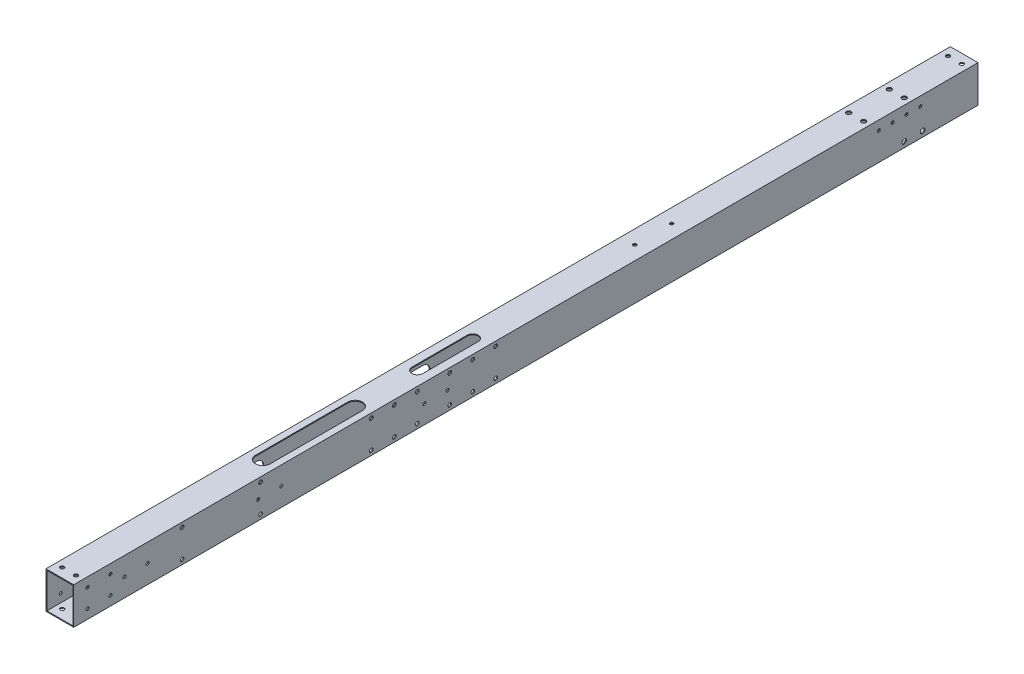
from build123d import *

# Parameters (mm, degrees)
SKETCH_1_W           = 30
SKETCH_1_H           = 40
SKETCH_1_W_2         = 28
SKETCH_1_H_2         = 38
EXTRUDE_1_DEPTH      = 940
SKETCH_5_R           = 2.5
CUT_EXTRUDE_3_DEPTH  = 941.97024395
CUT_EXTRUDE_4_DEPTH  = 1
SKETCH_7_R           = 1.5
CUT_EXTRUDE_5_DEPTH  = 1
SKETCH_17_W          = 30
SKETCH_17_H          = 40
SKETCH_17_W_2        = 28
SKETCH_17_H_2        = 38
EXTRUDE_2_DEPTH      = 20
SKETCH_18_W          = 30
SKETCH_18_H          = 40
SKETCH_18_W_2        = 28
SKETCH_18_H_2        = 38
EXTRUDE_3_DEPTH      = 20
SKETCH_19_R          = 2.1
CUT_EXTRUDE_16_DEPTH = 961.950050731
SKETCH_20_R          = 1.6
CUT_EXTRUDE_17_DEPTH = 961.67684473
SKETCH_21_R          = 2.5
SKETCH_21_R_2        = 1.6
CUT_EXTRUDE_18_DEPTH = 961.67684473
SKETCH_23_R          = 2.5
CUT_EXTRUDE_19_DEPTH = 961.950050731
SKETCH_24_R          = 4.5
CUT_EXTRUDE_20_DEPTH = 10
SKETCH_25_W          = 114.67616049
SKETCH_25_H          = 1154.562704257
CUT_EXTRUDE_21_DEPTH = 968.690549711
SKETCH_26_R          = 2
CUT_EXTRUDE_22_DEPTH = 961.67684473
CUT_EXTRUDE_23_DEPTH = 10
SKETCH_29_R          = 1.5
CUT_EXTRUDE_25_DEPTH = 10
CUT_EXTRUDE_26_DEPTH = 10
SKETCH_31_R          = 1.75
CUT_EXTRUDE_27_DEPTH = 10
SKETCH_34_W          = 70
SKETCH_34_H          = 15
CUT_EXTRUDE_28_DEPTH = 10
EXTRUDE_4_DEPTH      = 1
SKETCH_36_W          = 50.706907747
SKETCH_36_H          = 15.381529857
EXTRUDE_5_DEPTH      = 1
FILLET_1_R           = 3
SKETCH_37_R          = 1.75
CUT_EXTRUDE_29_DEPTH = 81
SKETCH_39_W          = 33.04876618
SKETCH_39_H          = 8.235453061
SKETCH_39_W_2        = 28.839368921
SKETCH_39_H_2        = 9.938064258
EXTRUDE_6_DEPTH      = 1
SKETCH_41_W          = 53.968695117
SKETCH_41_H          = 20.437849039
SKETCH_41_W_2        = 57.741002254
SKETCH_41_H_2        = 19.227533359
EXTRUDE_7_DEPTH      = 1
SKETCH_38_R          = 1.65
CUT_EXTRUDE_30_DEPTH = 93
CUT_EXTRUDE_31_DEPTH = 1


with BuildPart() as part:
    # 草图1 → 凸台-拉伸1 (new body)
    with BuildSketch(Plane.XY):
        Rectangle(SKETCH_1_W, SKETCH_1_H)
        Rectangle(SKETCH_1_W_2, SKETCH_1_H_2, mode=Mode.SUBTRACT)
    extrude(amount=EXTRUDE_1_DEPTH)

    # 草图5 → 切除-拉伸3 (cut, through all)
    with BuildSketch(Plane.XZ.offset(20)):
        with Locations((-8, 53)):
            Circle(SKETCH_5_R)
        with Locations((8, 53)):
            Circle(SKETCH_5_R)
        with Locations((-8, 97)):
            Circle(SKETCH_5_R)
        with Locations((8, 97)):
            Circle(SKETCH_5_R)
    extrude(amount=-CUT_EXTRUDE_3_DEPTH, mode=Mode.SUBTRACT)

    # 草图6 → 切除-拉伸4 (cut)
    with BuildSketch(Plane(origin=(15, 0, 0), x_dir=(0, 0, -1), z_dir=(1, 0, 0))):
        with BuildLine():
            Line((-345, -7.5), (-375, -7.5))
            ThreePointArc((-375, -7.5), (-382.5, 0), (-375, 7.5))
            Line((-375, 7.5), (-345, 7.5))
            ThreePointArc((-345, 7.5), (-337.5, 0), (-345, -7.5))
        make_face()
        with BuildLine():
            Line((-525, -7.5), (-555, -7.5))
            ThreePointArc((-555, -7.5), (-562.5, 0), (-555, 7.5))
            Line((-555, 7.5), (-525, 7.5))
            ThreePointArc((-525, 7.5), (-517.5, 0), (-525, -7.5))
        make_face()
        with BuildLine():
            Line((-705, -7.5), (-735, -7.5))
            ThreePointArc((-735, -7.5), (-742.5, 0), (-735, 7.5))
            Line((-735, 7.5), (-705, 7.5))
            ThreePointArc((-705, 7.5), (-697.5, 0), (-705, -7.5))
        make_face()
    extrude(amount=-CUT_EXTRUDE_4_DEPTH, mode=Mode.SUBTRACT)

    # 草图7 → 切除-拉伸5 (cut)
    with BuildSketch(Plane.ZY.offset(15)):
        with Locations((350, 0)):
            Circle(SKETCH_7_R)
        with Locations((370, 0)):
            Circle(SKETCH_7_R)
        with Locations((530, 0)):
            Circle(SKETCH_7_R)
        with Locations((550, 0)):
            Circle(SKETCH_7_R)
        with Locations((710, 0)):
            Circle(SKETCH_7_R)
        with Locations((730, 0)):
            Circle(SKETCH_7_R)
    extrude(amount=-CUT_EXTRUDE_5_DEPTH, mode=Mode.SUBTRACT)

    # 草图17 → 凸台-拉伸2 (add)
    with BuildSketch(Plane.XY.offset(940)):
        Rectangle(SKETCH_17_W, SKETCH_17_H)
        Rectangle(SKETCH_17_W_2, SKETCH_17_H_2, mode=Mode.SUBTRACT)
    extrude(amount=EXTRUDE_2_DEPTH)

    # 草图18 → 凸台-拉伸3 (add)
    with BuildSketch(Plane(origin=(0, 0, 0), x_dir=(-1, 0, 0), z_dir=(0, 0, -1))):
        Rectangle(SKETCH_18_W, SKETCH_18_H)
        Rectangle(SKETCH_18_W_2, SKETCH_18_H_2, mode=Mode.SUBTRACT)
    extrude(amount=EXTRUDE_3_DEPTH)

    # 草图19 → 切除-拉伸16 (cut, through all)
    with BuildSketch(Plane(origin=(0, 20, 0), x_dir=(1, 0, 0), z_dir=(0, 1, 0))):
        with Locations((-7.5, -950)):
            Circle(SKETCH_19_R)
        with Locations((7.5, -950)):
            Circle(SKETCH_19_R)
        with Locations((-7.5, 10)):
            Circle(SKETCH_19_R)
        with Locations((7.5, 10)):
            Circle(SKETCH_19_R)
    extrude(amount=-CUT_EXTRUDE_16_DEPTH, mode=Mode.SUBTRACT)

    # 草图20 → 切除-拉伸17 (cut, through all)
    with BuildSketch(Plane(origin=(15, 0, 0), x_dir=(0, 0, -1), z_dir=(1, 0, 0))):
        with Locations((-945, 10)):
            Circle(SKETCH_20_R)
        with Locations((-920, 10)):
            Circle(SKETCH_20_R)
        with Locations((-920, -10)):
            Circle(SKETCH_20_R)
        with Locations((-945, -10)):
            Circle(SKETCH_20_R)
    extrude(amount=-CUT_EXTRUDE_17_DEPTH, mode=Mode.SUBTRACT)

    # 草图21 → 切除-拉伸18 (cut, through all)
    with BuildSketch(Plane(origin=(15, 0, 0), x_dir=(0, 0, -1), z_dir=(1, 0, 0))):
        with Locations((-40, -14)):
            Circle(SKETCH_21_R)
        with Locations((-60, -14)):
            Circle(SKETCH_21_R)
        with Locations((-42.5, 10)):
            Circle(SKETCH_21_R_2)
        with Locations((-57.5, 10)):
            Circle(SKETCH_21_R_2)
        with Locations((-72.5, 10)):
            Circle(SKETCH_21_R_2)
        with Locations((-87.5, 10)):
            Circle(SKETCH_21_R_2)
    extrude(amount=-CUT_EXTRUDE_18_DEPTH, mode=Mode.SUBTRACT)

    # 草图23 → 切除-拉伸19 (cut, through all)
    with BuildSketch(Plane(origin=(0, 20, 0), x_dir=(1, 0, 0), z_dir=(0, 1, 0))):
        with Locations((0, -520)):
            Circle(SKETCH_23_R)
        with Locations((0, -535)):
            Circle(SKETCH_23_R)
        with Locations((0, -550)):
            Circle(SKETCH_23_R)
        with Locations((0, -565)):
            Circle(SKETCH_23_R)
    extrude(amount=-CUT_EXTRUDE_19_DEPTH, mode=Mode.SUBTRACT)

    # 草图24 → 切除-拉伸20 (cut)
    with BuildSketch(Plane(origin=(0, 20, 0), x_dir=(1, 0, 0), z_dir=(0, 1, 0))):
        with Locations((0, -520)):
            Circle(SKETCH_24_R)
        with Locations((0, -535)):
            Circle(SKETCH_24_R)
        with Locations((0, -550)):
            Circle(SKETCH_24_R)
        with Locations((0, -565)):
            Circle(SKETCH_24_R)
    extrude(amount=-CUT_EXTRUDE_20_DEPTH, mode=Mode.SUBTRACT)


with BuildPart() as body_2:
    # 镜向2: mirrored copy
    add(part.part.mirror(Plane(origin=(-50, 0, 0), x_dir=(0, 0, 1), z_dir=(1, 0, 0))))

    # 草图26 → 切除-拉伸22 (cut, through all)
    with BuildSketch(Plane.ZY.offset(115)):
        with Locations((612.5, 15)):
            Circle(SKETCH_26_R)
        with Locations((612.5, -15)):
            Circle(SKETCH_26_R)
        with Locations((527.5, 15)):
            Circle(SKETCH_26_R)
        with Locations((527.5, -15)):
            Circle(SKETCH_26_R)
        with Locations((842.5, 15)):
            Circle(SKETCH_26_R)
        with Locations((842.5, -15)):
            Circle(SKETCH_26_R)
        with Locations((757.5, 15)):
            Circle(SKETCH_26_R)
        with Locations((757.5, -15)):
            Circle(SKETCH_26_R)
        with Locations((637.5, 15)):
            Circle(SKETCH_26_R)
        with Locations((637.5, -15)):
            Circle(SKETCH_26_R)
        with Locations((552.5, -15)):
            Circle(SKETCH_26_R)
        with Locations((552.5, 15)):
            Circle(SKETCH_26_R)
        with Locations((502.5, 15)):
            Circle(SKETCH_26_R)
        with Locations((502.5, -15)):
            Circle(SKETCH_26_R)
        with Locations((587.5, -15)):
            Circle(SKETCH_26_R)
        with Locations((587.5, 15)):
            Circle(SKETCH_26_R)
    extrude(amount=-CUT_EXTRUDE_22_DEPTH, mode=Mode.SUBTRACT)

    # 草图27 → 切除-拉伸23 (cut)
    with BuildSketch(Plane(origin=(0, 20, 0), x_dir=(1, 0, 0), z_dir=(0, 1, 0))):
        with BuildLine():
            Line((-94, -512.5), (-94, -572.5))
            ThreePointArc((-94, -572.5), (-100, -578.5), (-106, -572.5))
            Line((-106, -572.5), (-106, -512.5))
            ThreePointArc((-106, -512.5), (-100, -506.5), (-94, -512.5))
        make_face()
    extrude(amount=-CUT_EXTRUDE_23_DEPTH, mode=Mode.SUBTRACT)

    # 草图29 → 切除-拉伸25 (cut)
    with BuildSketch(Plane.XZ.offset(20)):
        with Locations((-105, 740)):
            Circle(SKETCH_29_R)
        with Locations((-105, 720)):
            Circle(SKETCH_29_R)
        with Locations((-105, 700)):
            Circle(SKETCH_29_R)
        with Locations((-105, 680)):
            Circle(SKETCH_29_R)
        with Locations((-105, 660)):
            Circle(SKETCH_29_R)
        with Locations((-105, 640)):
            Circle(SKETCH_29_R)
        with Locations((-105, 620)):
            Circle(SKETCH_29_R)
    extrude(amount=-CUT_EXTRUDE_25_DEPTH, mode=Mode.SUBTRACT)

    # 草图30 → 切除-拉伸26 (cut)
    with BuildSketch(Plane(origin=(0, 20, 0), x_dir=(1, 0, 0), z_dir=(0, 1, 0))):
        with BuildLine():
            Line((-92, -640), (-92, -740))
            ThreePointArc((-92, -740), (-100, -748), (-108, -740))
            Line((-108, -740), (-108, -640))
            ThreePointArc((-108, -640), (-100, -632), (-92, -640))
        make_face()
    extrude(amount=-CUT_EXTRUDE_26_DEPTH, mode=Mode.SUBTRACT)

    # 草图31 → 切除-拉伸27 (cut)
    with BuildSketch(Plane.XZ.offset(20)):
        with Locations((-100, 137)):
            Circle(SKETCH_31_R)
        with Locations((-100, 177)):
            Circle(SKETCH_31_R)
    extrude(amount=-CUT_EXTRUDE_27_DEPTH, mode=Mode.SUBTRACT)

    # 草图34 → 切除-拉伸28 (cut)
    with BuildSketch(Plane.ZY.offset(115)):
        with Locations((315, -11.5)):
            Rectangle(SKETCH_34_W, SKETCH_34_H)
    extrude(amount=-CUT_EXTRUDE_28_DEPTH, mode=Mode.SUBTRACT)

    # 草图35 → 凸台-拉伸4 (add)
    with BuildSketch(Plane.ZY.offset(115)):
        Polygon((336.145770334, -4), (350, -4), (350, -9.077366936), (391.920925018, -9.077366936), (391.920925018, 11.093373936), (336.145770334, 11.093373936), align=None)
    extrude(amount=-EXTRUDE_4_DEPTH)

    # 草图36 → 凸台-拉伸5 (add)
    with BuildSketch(Plane(origin=(-85, 0, 0), x_dir=(0, 0, -1), z_dir=(1, 0, 0))):
        with Locations((-354.422343157, -1.974054468)):
            Rectangle(SKETCH_36_W, SKETCH_36_H)
    extrude(amount=-EXTRUDE_5_DEPTH)

    # 圆角1
    fillet_1_edges = [body_2.edges().sort_by_distance(p)[0] for p in [
        (-114.5, -19, 350),
        (-114.5, -4, 350),
        (-114.5, -4, 280),
        (-114.5, -19, 280),
    ]]
    fillet(fillet_1_edges, radius=FILLET_1_R)

    # 草图37 → 切除-拉伸29 (cut)
    with BuildSketch(Plane.XZ.offset(20)):
        with Locations((-100, 297)):
            Circle(SKETCH_37_R)
        with Locations((-100, 337)):
            Circle(SKETCH_37_R)
    extrude(amount=-CUT_EXTRUDE_29_DEPTH, mode=Mode.SUBTRACT)

    # 草图39 → 凸台-拉伸6 (add)
    with BuildSketch(Plane(origin=(-85, 0, 0), x_dir=(0, 0, -1), z_dir=(1, 0, 0))):
        with Locations((-716.005404382, 0.278572404)):
            Rectangle(SKETCH_39_W, SKETCH_39_H)
        with Locations((-538.020368458, 0.344207478)):
            Rectangle(SKETCH_39_W_2, SKETCH_39_H_2)
    extrude(amount=-EXTRUDE_6_DEPTH)

    # 草图41 → 凸台-拉伸7 (add)
    with BuildSketch(Plane.ZY.offset(115)):
        with Locations((541.407114178, 0.400095075)):
            Rectangle(SKETCH_41_W, SKETCH_41_H)
        with Locations((717.500112012, 1.005252915)):
            Rectangle(SKETCH_41_W_2, SKETCH_41_H_2)
    extrude(amount=-EXTRUDE_7_DEPTH)

    # 草图38 → 切除-拉伸30 (cut)
    with BuildSketch(Plane(origin=(-85, 0, 0), x_dir=(0, 0, -1), z_dir=(1, 0, 0))):
        with Locations((-905, 0)):
            Circle(SKETCH_38_R)
        with Locations((-880, 0)):
            Circle(SKETCH_38_R)
        with Locations((-760, 0)):
            Circle(SKETCH_38_R)
        with Locations((-735, 0)):
            Circle(SKETCH_38_R)
        with Locations((-580, 0)):
            Circle(SKETCH_38_R)
        with Locations((-555, 0)):
            Circle(SKETCH_38_R)
    extrude(amount=-CUT_EXTRUDE_30_DEPTH, mode=Mode.SUBTRACT)

    # 草图42 → 切除-拉伸31 (cut)
    with BuildSketch(Plane.ZY.offset(115)):
        with BuildLine():
            Line((877.5, 7.5), (907.5, 7.5))
            ThreePointArc((907.5, 7.5), (915, 0), (907.5, -7.5))
            Line((907.5, -7.5), (877.5, -7.5))
            ThreePointArc((877.5, -7.5), (870, 0), (877.5, 7.5))
        make_face()
        with BuildLine():
            Line((732.5, 7.5), (762.5, 7.5))
            ThreePointArc((762.5, 7.5), (770, 0), (762.5, -7.5))
            Line((762.5, -7.5), (732.5, -7.5))
            ThreePointArc((732.5, -7.5), (725, 0), (732.5, 7.5))
        make_face()
        with BuildLine():
            Line((552.5, 7.5), (582.5, 7.5))
            ThreePointArc((582.5, 7.5), (590, 0), (582.5, -7.5))
            Line((582.5, -7.5), (552.5, -7.5))
            ThreePointArc((552.5, -7.5), (545, 0), (552.5, 7.5))
        make_face()
    extrude(amount=-CUT_EXTRUDE_31_DEPTH, mode=Mode.SUBTRACT)


with BuildPart() as part_1:
    add(part.part)

    # 草图25 → 切除-拉伸21 (cut, through all)
    with BuildSketch(Plane(origin=(0, 20, 0), x_dir=(1, 0, 0), z_dir=(0, 1, 0))):
        with Locations((7.338080245, -506.215166959)):
            Rectangle(SKETCH_25_W, SKETCH_25_H)
    extrude(amount=-CUT_EXTRUDE_21_DEPTH, mode=Mode.SUBTRACT)


solid = body_2.part
